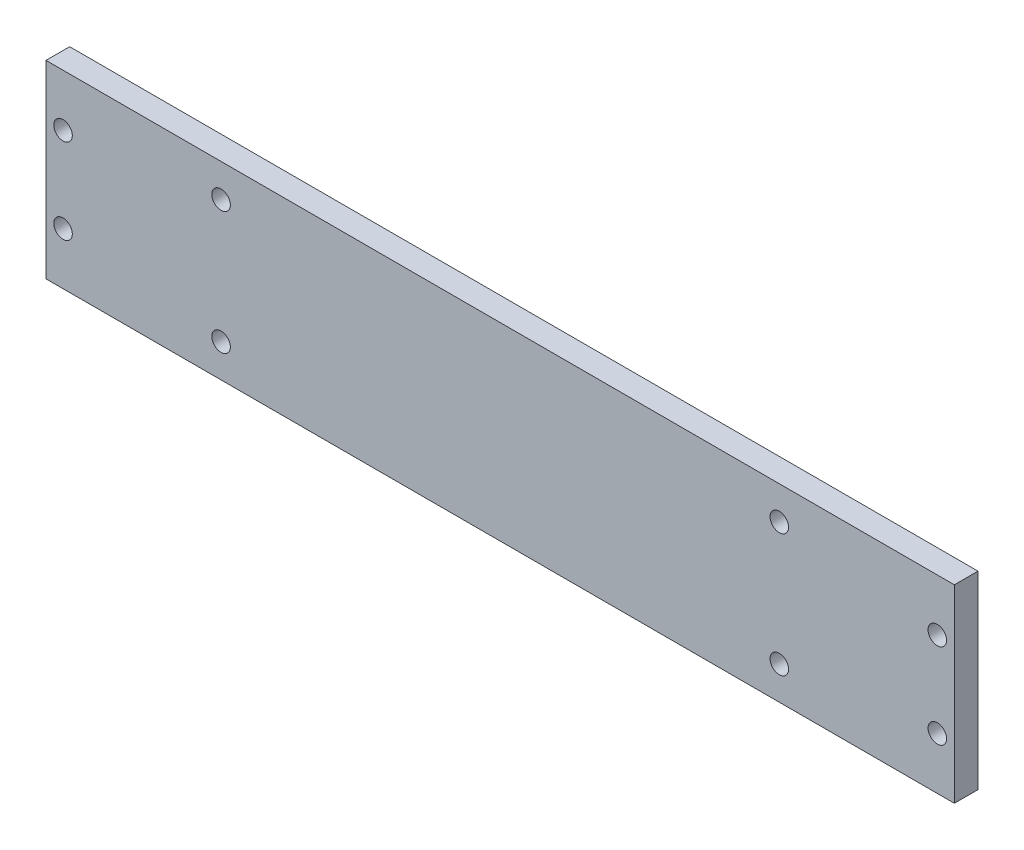
from build123d import *

# Parameters (mm, degrees)
SKETCH1_W              = 243.84
SKETCH1_H              = 50.8
BOSS_EXTRUDE1_DEPTH    = 6.35
F_10_CLEARANCE_HOLE1_D = 4.9784


with BuildPart() as part:
    # Sketch1 → Boss-Extrude1 (new body)
    with BuildSketch(Plane.XY):
        Rectangle(SKETCH1_W, SKETCH1_H)
    extrude(amount=BOSS_EXTRUDE1_DEPTH)

    # #10 Clearance Hole1 (through all)
    with Locations(Plane.XY.offset(6.35)):
        with Locations((-74.93, 16.51), (-74.93, -16.51), (74.93, 16.51), (74.93, -16.51), (-117.348, 11.43), (-117.348, -11.43), (117.348, 11.43), (117.348, -11.43)):
            Hole(F_10_CLEARANCE_HOLE1_D / 2)


solid = part.part
